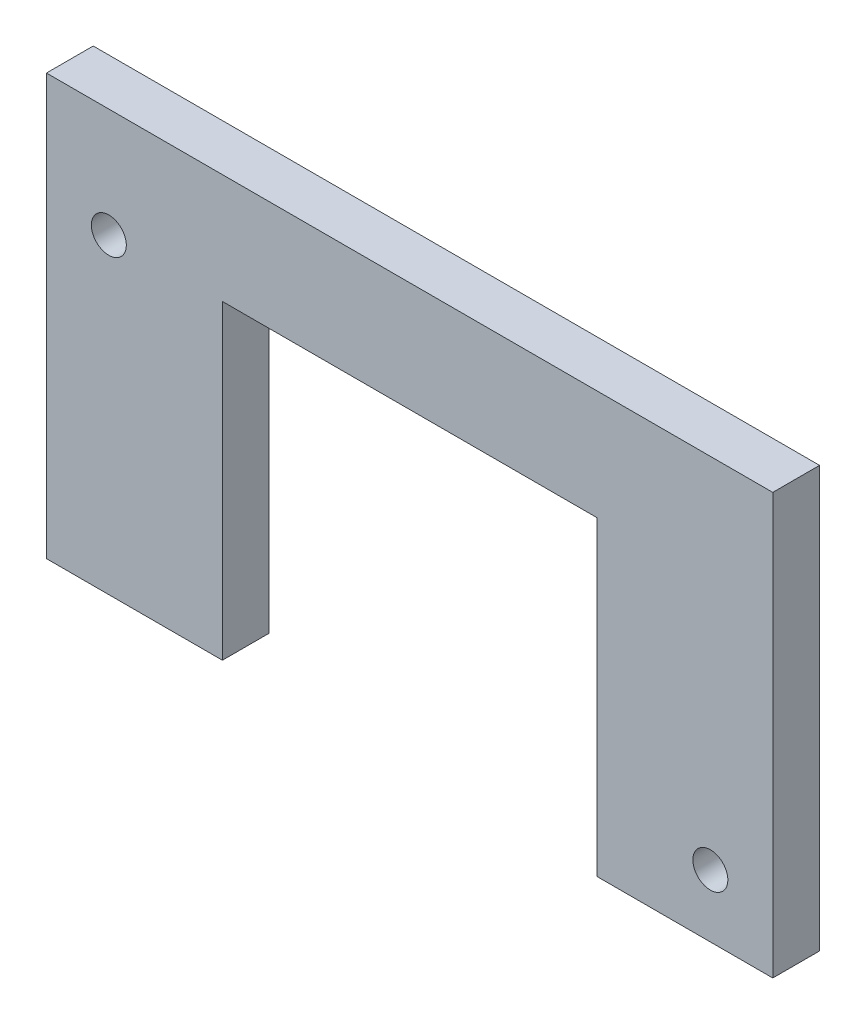
from build123d import *

# Parameters (mm, degrees)
SKETCH1_W           = 36.957
SKETCH1_H           = 21.3995
SKETCH1_R           = 0.889
BOSS_EXTRUDE1_DEPTH = 2.38125
CUT_EXTRUDE1_REACH  = 42.61
SKETCH2_W           = 19.05
SKETCH2_H           = 15.8115


with BuildPart() as part:
    # Sketch1 → Boss-Extrude1 (new body)
    with BuildSketch(Plane.XY):
        with Locations((16.891, 9.11225)):
            Rectangle(SKETCH1_W, SKETCH1_H)
        with Locations((1.5875, 14.25575)):
            Circle(SKETCH1_R, mode=Mode.SUBTRACT)
        with Locations((32.1945, 1.5875)):
            Circle(SKETCH1_R, mode=Mode.SUBTRACT)
    extrude(amount=BOSS_EXTRUDE1_DEPTH)

    # Sketch2 → Cut-Extrude1 (cut, up to next)
    with BuildSketch(Plane.XY.offset(2.38125), mode=Mode.PRIVATE) as cut_extrude1_sk1:
        with Locations((16.891, 6.31825)):
            Rectangle(SKETCH2_W, SKETCH2_H)
    cut_extrude1_tool1 = extrude(cut_extrude1_sk1.sketch, amount=-CUT_EXTRUDE1_REACH, mode=Mode.PRIVATE) & part.part
    add(cut_extrude1_tool1.solids().sort_by_distance((16.891, 6.31825, 2.38125))[0], mode=Mode.SUBTRACT)


solid = part.part
